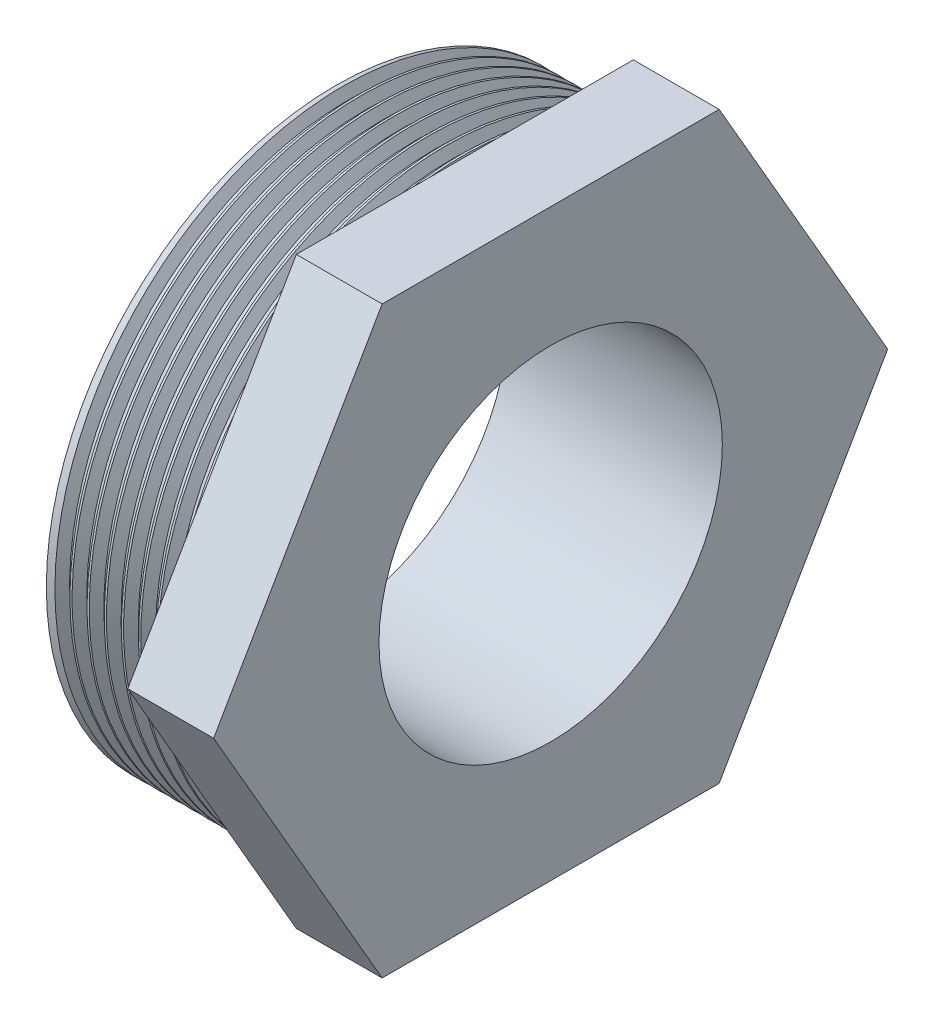
from build123d import *
from build123d.topology import SkipClean

# Parameters (mm, degrees)
SKETCH1_R           = 20
BOSS_EXTRUDE1_DEPTH = 10
BOSS_EXTRUDE2_START = 15
SKETCH2_R           = 33.75
SKETCH2_R_2         = 20
BOSS_EXTRUDE2_DEPTH = 15
THREAD1_PITCH       = 2


with BuildPart() as part:
    # Sketch1 → Boss-Extrude1 (new body)
    with BuildSketch(Plane(origin=(0, 0, 0), x_dir=(0, 0, -1), z_dir=(1, 0, 0))):
        Polygon((39.259818305, 0), (19.629909152, 34), (-19.629909152, 34), (-39.259818305, 0), (-19.629909152, -34), (19.629909152, -34), align=None)
        Circle(SKETCH1_R, mode=Mode.SUBTRACT)
    extrude(amount=BOSS_EXTRUDE1_DEPTH)

    # Sketch2 → Boss-Extrude2 (add)
    with SkipClean():  # the faces are left unmerged after this step: merging them gives an invalid solid
        with BuildSketch(Plane.ZY.offset(BOSS_EXTRUDE2_START)):
            Circle(SKETCH2_R)
            Circle(SKETCH2_R_2, mode=Mode.SUBTRACT)
        extrude(amount=-BOSS_EXTRUDE2_DEPTH)

    # Thread1: the profile of Thread Profile4 profile screwed along a right-hand helix of 7.5 turns, 10 arcs to a turn; built about Z, then put on its axis
    with SkipClean():  # the faces are left unmerged after this step: merging them gives an invalid solid
        thread1_z = Axis((0, 0, 0), (0, 0, 1))
        thread1_corners = [(33.7503, 0, -0.000173205), (33.7503, 0, 1.7501732), (32.66746825, 0, 1.124999997), (32.66746825, 0, 0.624999997)]
        with BuildLine(mode=Mode.PRIVATE) as thread1_profile:
            Line(thread1_corners[0], thread1_corners[1])
            Line(thread1_corners[1], thread1_corners[2])
            Line(thread1_corners[2], thread1_corners[3])
            Line(thread1_corners[3], thread1_corners[0])
        thread1_cap = Face(thread1_profile.wire())
        thread1_turn_angles = [0, 18, 36, 54, 72, 90, 108, 126, 144, 162, 180, 198, 216, 234, 252, 270, 288, 306, 324, 342, 360]
        thread1_turn_weights = [1, 0.9510565162951535, 1, 0.9510565162951535, 1, 0.9510565162951535, 1, 0.9510565162951535, 1, 0.9510565162951535, 1, 0.9510565162951535, 1, 0.9510565162951535, 1, 0.9510565162951535, 1, 0.9510565162951535, 1, 0.9510565162951535, 1]
        thread1_turn_rails = [Edge.make_bspline([Vector(p[0], p[1], 0).rotate(thread1_z, thread1_turn_angles[k]) / thread1_turn_weights[k] + Vector(0, 0, p[2] + THREAD1_PITCH * thread1_turn_angles[k] / 360) for k in range(21)], [0, 0, 0, 1, 1, 2, 2, 3, 3, 4, 4, 5, 5, 6, 6, 7, 7, 8, 8, 9, 9, 10, 10, 10], 2, thread1_turn_weights) for p in thread1_corners]
        thread1_turn_sides = [Face.make_surface_from_curves(thread1_turn_rails[p[0]], thread1_turn_rails[p[1]]) for p in [(0, 1), (1, 2), (2, 3), (3, 0)]]
        thread1_last_angles = [2520, 2538, 2556, 2574, 2592, 2610, 2628, 2646, 2664, 2682, 2700]
        thread1_last_weights = [1, 0.9510565162951535, 1, 0.9510565162951535, 1, 0.9510565162951535, 1, 0.9510565162951535, 1, 0.9510565162951535, 1]
        thread1_last_rails = [Edge.make_bspline([Vector(p[0], p[1], 0).rotate(thread1_z, thread1_last_angles[k]) / thread1_last_weights[k] + Vector(0, 0, p[2] + THREAD1_PITCH * thread1_last_angles[k] / 360) for k in range(11)], [0, 0, 0, 1, 1, 2, 2, 3, 3, 4, 4, 5, 5, 5], 2, thread1_last_weights) for p in thread1_corners]
        thread1_last_sides = [Face.make_surface_from_curves(thread1_last_rails[p[0]], thread1_last_rails[p[1]]) for p in [(0, 1), (1, 2), (2, 3), (3, 0)]]
        thread1 = Plane(origin=(-15, 0, 0), x_dir=(0, 0, -1), z_dir=(1, 0, 0)) * Solid(Shell([*[p.moved(Location((0, 0, THREAD1_PITCH * i))) for i in range(7) for p in thread1_turn_sides], *thread1_last_sides, thread1_cap, thread1_cap.rotate(thread1_z, 2700).moved(Location((0, 0, THREAD1_PITCH * 2700 / 360)))]))
        add(thread1, mode=Mode.SUBTRACT)


solid = part.part
